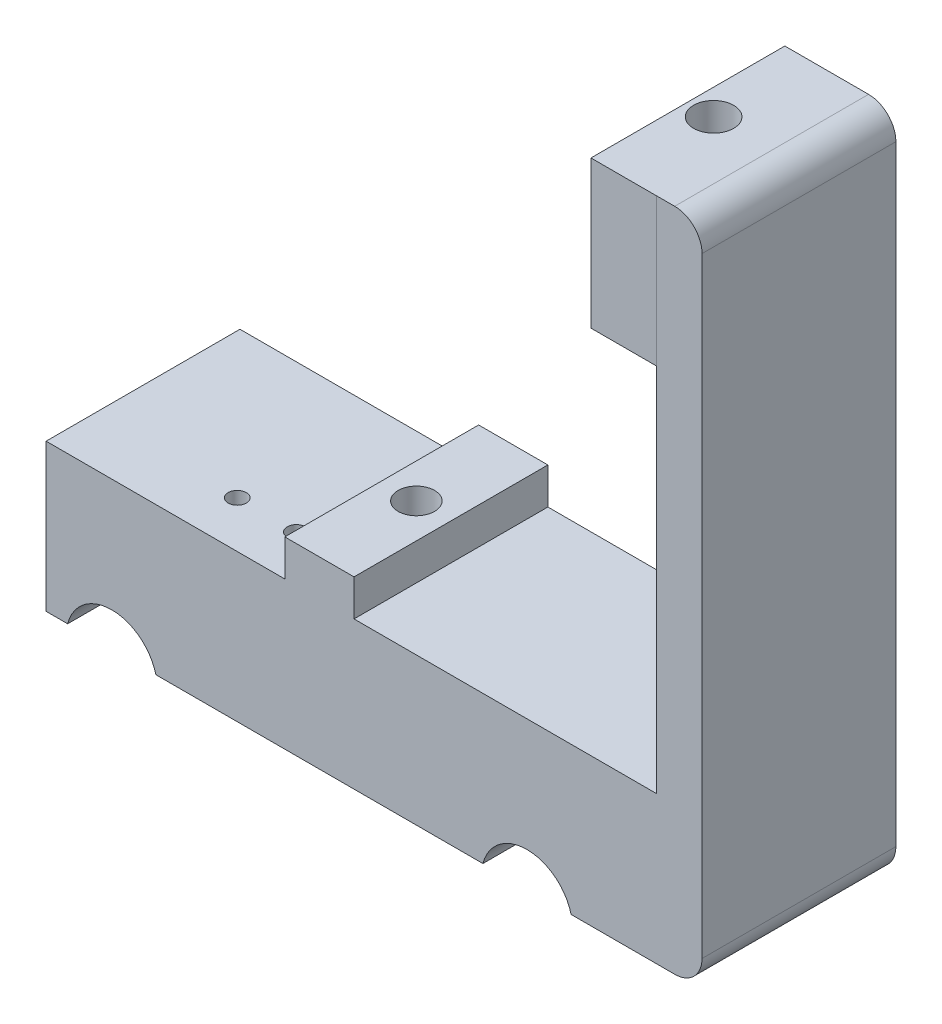
from build123d import *

# Parameters (mm, degrees)
BOSS_EXTRUDE1_DEPTH     = 10.8
BOSS_EXTRUDE2_DEPTH     = 10.64
CUT_EXTRUDE1_DEPTH      = 39.168054705
CUT_EXTRUDE1_DEPTH_BACK = 39.168054705
SKETCH5_R               = 5
FILLET1_R               = 1
SKETCH6_W               = 21.28
SKETCH6_H               = 16.18
BOSS_EXTRUDE3_DEPTH     = 12
SKETCH7_W               = 5
SKETCH7_H               = 21.281328743
BOSS_EXTRUDE4_DEPTH     = 56.83
SKETCH8_W               = 21.284331222
SKETCH8_H               = 16.18
BOSS_EXTRUDE5_DEPTH     = 7.19
FILLET3_R               = 3
SKETCH9_R               = 2.2
CUT_EXTRUDE2_DEPTH      = 85.918196519
SKETCH10_R              = 2
CUT_EXTRUDE3_DEPTH      = 85.918196519
SKETCH11_W              = 24.977296572
SKETCH11_H              = 9.721484234
CUT_EXTRUDE4_DEPTH      = 71.220021919
CUT_EXTRUDE5_REACH      = 86.898


with BuildPart() as part:
    # Sketch2 → Boss-Extrude1 (new body)
    with BuildSketch(Plane.XY):
        Polygon((10.1, 0), (10.1, 1.709943763), (6.25480432, 7), (-6.25480432, 7), (-10.1, 1.709943763), (-10.1, 0), align=None)
    extrude(amount=BOSS_EXTRUDE1_DEPTH)

    # Sketch4 → Boss-Extrude2 (add, symmetric)
    with BuildSketch(Plane.XY):
        Polygon((-3.8, 0), (-3.8, -4.8), (-30, -4.8), (-30, -20.98), (30, -20.98), (30, -4.8), (3.8, -4.8), (3.8, 0), align=None)
    extrude(amount=BOSS_EXTRUDE2_DEPTH, both=True)

    # Sketch5 → Cut-Extrude1 (cut, two sides: drawn at the far end of the back side and taken through both)
    with BuildSketch(Plane.XY.offset(-CUT_EXTRUDE1_DEPTH_BACK)):
        with Locations((-22.790976064, -22.227391232)):
            Circle(SKETCH5_R)
        with Locations((22.790976064, -22.227391232)):
            Circle(SKETCH5_R)
    extrude(amount=CUT_EXTRUDE1_DEPTH + CUT_EXTRUDE1_DEPTH_BACK, mode=Mode.SUBTRACT)

    # Fillet1
    fillet1_edges = [part.edges().sort_by_distance(p)[0] for p in [
        (-10.1, 0, 5.4),
        (-10.1, 1.709943763, 5.4),
        (-6.25480432, 7, 5.4),
        (6.25480432, 7, 5.4),
        (10.1, 0, 5.4),
        (10.1, 1.709943763, 5.4),
    ]]
    fillet(fillet1_edges, radius=FILLET1_R)

    # Sketch6 → Boss-Extrude3 (add)
    with BuildSketch(Plane(origin=(30, 0, 0), x_dir=(0, 0, -1), z_dir=(1, 0, 0))):
        with Locations((0, -12.89)):
            Rectangle(SKETCH6_W, SKETCH6_H)
    extrude(amount=BOSS_EXTRUDE3_DEPTH)

    # Sketch7 → Boss-Extrude4 (add)
    with BuildSketch(Plane(origin=(0, -4.8, 0), x_dir=(1, 0, 0), z_dir=(0, 1, 0))):
        with Locations((39.5, 0.000664372)):
            Rectangle(SKETCH7_W, SKETCH7_H)
    extrude(amount=BOSS_EXTRUDE4_DEPTH)

    # Sketch8 → Boss-Extrude5 (add)
    with BuildSketch(Plane.ZY.offset(-37)):
        with Locations((0.000836868, 43.94)):
            Rectangle(SKETCH8_W, SKETCH8_H)
    extrude(amount=BOSS_EXTRUDE5_DEPTH)

    # Fillet3
    fillet3_edges = [part.edges().sort_by_distance(p)[0] for p in [
        (42, 52.03, -0.000664372),
        (42, -20.98, 0),
    ]]
    fillet(fillet3_edges, radius=FILLET3_R)

    # Sketch9 → Cut-Extrude2 (cut, through all)
    with BuildSketch(Plane.XZ.offset(20.98)):
        with Locations((32.632878078, 0)):
            Circle(SKETCH9_R)
    extrude(amount=-CUT_EXTRUDE2_DEPTH, mode=Mode.SUBTRACT)

    # Sketch10 → Cut-Extrude3 (cut, through all)
    with BuildSketch(Plane.XZ.offset(20.98)):
        with Locations((0.000925951, 0)):
            Circle(SKETCH10_R)
    extrude(amount=-CUT_EXTRUDE3_DEPTH, mode=Mode.SUBTRACT)

    # Sketch11 → Cut-Extrude4 (cut, through all)
    with BuildSketch(Plane.XY.offset(10.8)):
        with Locations((-0.121132817, 4.060742117)):
            Rectangle(SKETCH11_W, SKETCH11_H)
    extrude(amount=-CUT_EXTRUDE4_DEPTH, mode=Mode.SUBTRACT)

    # Sketch12 → Cut-Extrude5 (cut, up to next)
    with BuildSketch(Plane.XZ.offset(20.98), mode=Mode.PRIVATE) as cut_extrude5_sk1:
        with BuildLine():
            ThreePointArc((-8.626172213, 5.53800248), (-7.626172213, 4.53800248), (-6.626172213, 5.53800248))
            ThreePointArc((-6.626172213, 5.53800248), (-7.626172213, 6.53800248), (-8.626172213, 5.53800248))
        make_face()
    cut_extrude5_tool1 = extrude(cut_extrude5_sk1.sketch, amount=-CUT_EXTRUDE5_REACH, mode=Mode.PRIVATE) & part.part
    # Sketch12 → Cut-Extrude5 (cut, up to next)
    with BuildSketch(Plane.XZ.offset(20.98), mode=Mode.PRIVATE) as cut_extrude5_sk2:
        with BuildLine():
            ThreePointArc((-15.126172213, 5.53800248), (-14.126172213, 4.53800248), (-13.126172213, 5.53800248))
            ThreePointArc((-13.126172213, 5.53800248), (-14.126172213, 6.53800248), (-15.126172213, 5.53800248))
        make_face()
    cut_extrude5_tool2 = extrude(cut_extrude5_sk2.sketch, amount=-CUT_EXTRUDE5_REACH, mode=Mode.PRIVATE) & part.part
    add(cut_extrude5_tool1.solids().sort_by_distance((-7.626172, -20.98, 5.538002))[0], mode=Mode.SUBTRACT)
    add(cut_extrude5_tool2.solids().sort_by_distance((-14.126172, -20.98, 5.538002))[0], mode=Mode.SUBTRACT)


solid = part.part
